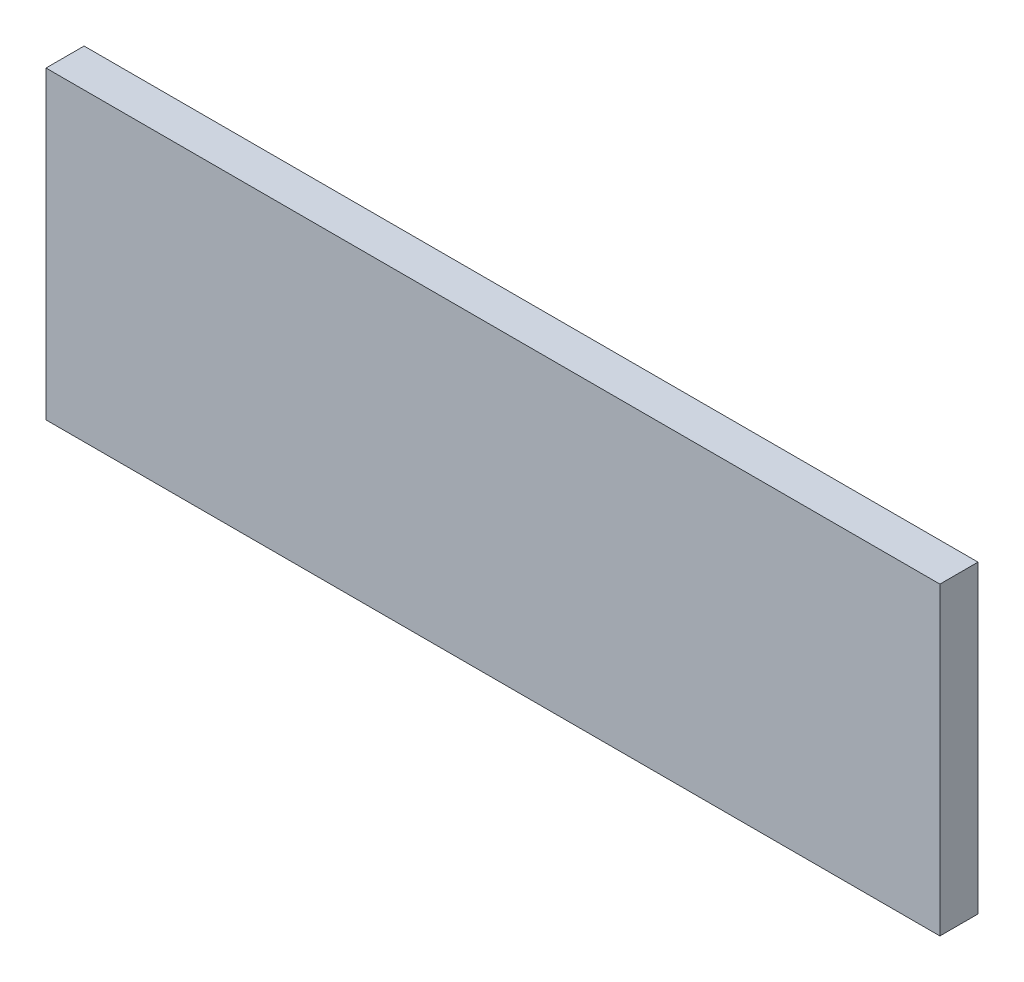
from build123d import *

# Parameters (mm, degrees)
SKETCH1_W           = 279.4
SKETCH1_H           = 95.25
BOSS_EXTRUDE1_DEPTH = 11.90625


with BuildPart() as part:
    # Sketch1 → Boss-Extrude1 (new body)
    with BuildSketch(Plane.XY):
        with Locations((35.845035656, 1.696353708)):
            Rectangle(SKETCH1_W, SKETCH1_H)
    extrude(amount=BOSS_EXTRUDE1_DEPTH)


solid = part.part
